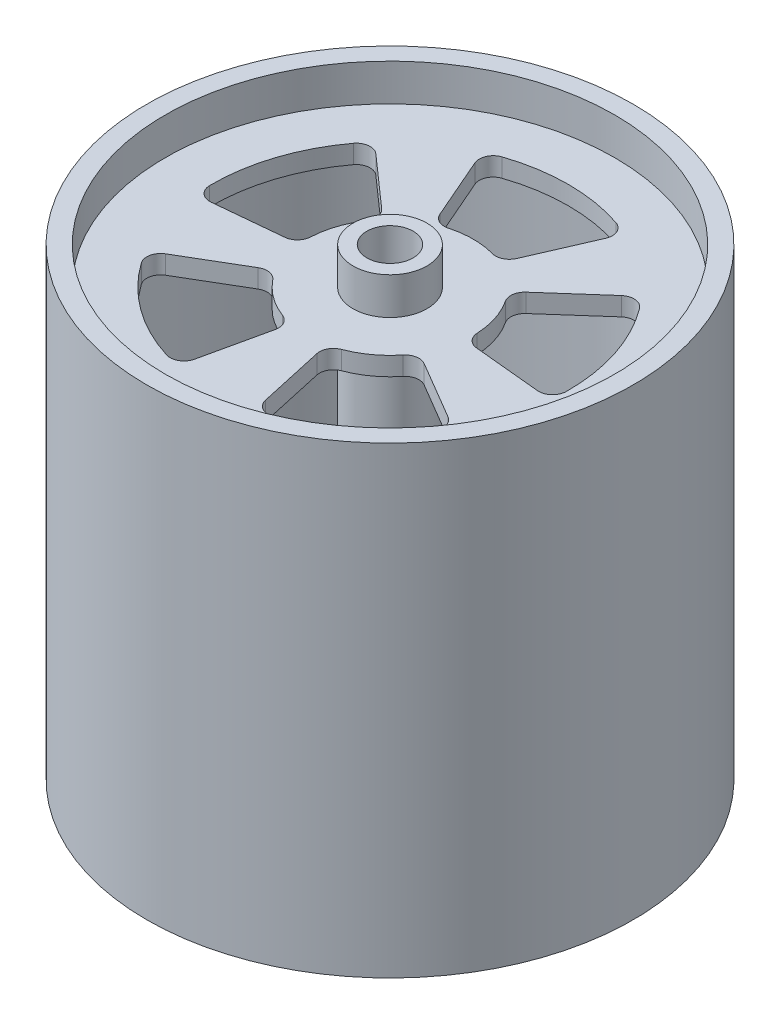
from build123d import *

# Parameters (mm, degrees)
SKETCH1_R           = 52.5
SKETCH1_R_2         = 48.5
BOSS_EXTRUDE1_DEPTH = 100
SKETCH2_R           = 5
BOSS_EXTRUDE2_DEPTH = 100
BOSS_EXTRUDE3_START = -8
SKETCH2_3_R         = 48.5
SKETCH2_3_R_2       = 8
BOSS_EXTRUDE3_DEPTH = 4
BOSS_EXTRUDE4_START = -88
SKETCH2_4_R         = 48.5
SKETCH2_4_R_2       = 8
BOSS_EXTRUDE4_DEPTH = 4


with BuildPart() as part:
    # Sketch1 → Boss-Extrude1 (new body)
    with BuildSketch(Plane(origin=(0, 0, 0), x_dir=(1, 0, 0), z_dir=(0, 1, 0))):
        Circle(SKETCH1_R)
        Circle(SKETCH1_R_2, mode=Mode.SUBTRACT)
    extrude(amount=BOSS_EXTRUDE1_DEPTH)



with BuildPart() as body_2:
    # Sketch2 → Boss-Extrude2 (new body)
    with BuildSketch(Plane.XZ):
        with BuildLine():
            ThreePointArc((8, 0), (7.901506725, 1.25147572), (7.60845213, 2.472135955))
            ThreePointArc((7.60845213, 2.472135955), (4.702282018, 6.472135955), (0, 8))
            ThreePointArc((0, 8), (-5.656854249, -5.656854249), (8, 0))
        make_face()
        Circle(SKETCH2_R, mode=Mode.SUBTRACT)
    extrude(amount=-BOSS_EXTRUDE2_DEPTH)


with BuildPart() as part_1:
    add(part.part)

    add(body_2.part)  # Boss-Extrude3 merges body 2
    # Sketch2<3> → Boss-Extrude3 (add)
    with BuildSketch(Plane.XZ.offset(BOSS_EXTRUDE3_START)):
        Circle(SKETCH2_3_R)
        Circle(SKETCH2_3_R_2, mode=Mode.SUBTRACT)
        with BuildLine():
            Line((4.498612897, 20.291931451), (7.656121129, 34.53453068))
            ThreePointArc((7.656121129, 34.53453068), (9.081556968, 36.48129187), (11.479516965, 36.748750866))
            ThreePointArc((11.479516965, 36.748750866), (22.629732213, 31.147154283), (31.402773148, 22.273657954))
            ThreePointArc((31.402773148, 22.273657954), (31.889414918, 19.910413097), (30.4784189, 17.953160762))
            Line((30.4784189, 17.953160762), (17.908625798, 10.548986777))
            ThreePointArc((17.908625798, 10.548986777), (15.84479345, 10.183097432), (14.045152036, 11.257606507))
            ThreePointArc((14.045152036, 11.257606507), (10.580134541, 14.562305899), (6.366429359, 16.836525093))
            ThreePointArc((6.366429359, 16.836525093), (4.78839072, 18.216044222), (4.498612897, 20.291931451))
        make_face(mode=Mode.SUBTRACT)
        with BuildLine():
            ThreePointArc((-31.402773148, 22.273657954), (-22.629732213, 31.147154283), (-11.479516965, 36.748750866))
            ThreePointArc((-11.479516965, 36.748750866), (-9.081556968, 36.48129187), (-7.656121129, 34.53453068))
            Line((-7.656121129, 34.53453068), (-4.498612897, 20.291931451))
            ThreePointArc((-4.498612897, 20.291931451), (-4.78839072, 18.216044222), (-6.366429359, 16.836525093))
            ThreePointArc((-6.366429359, 16.836525093), (-10.580134541, 14.562305899), (-14.045152036, 11.257606507))
            ThreePointArc((-14.045152036, 11.257606507), (-15.84479345, 10.183097432), (-17.908625798, 10.548986777))
            Line((-17.908625798, 10.548986777), (-30.4784189, 17.953160762))
            ThreePointArc((-30.4784189, 17.953160762), (-31.889414918, 19.910413097), (-31.402773148, 22.273657954))
        make_face(mode=Mode.SUBTRACT)
        with BuildLine():
            Line((8.287843762, -19.060735709), (14.104955724, -32.439177302))
            ThreePointArc((14.104955724, -32.439177302), (14.096031424, -34.851990353), (12.313249487, -36.477854749))
            ThreePointArc((12.313249487, -36.477854749), (0, -38.5), (-12.313249487, -36.477854749))
            ThreePointArc((-12.313249487, -36.477854749), (-14.096031424, -34.851990353), (-14.104955724, -32.439177302))
            Line((-14.104955724, -32.439177302), (-8.287843762, -19.060735709))
            ThreePointArc((-8.287843762, -19.060735709), (-6.83323268, -17.551634794), (-4.745711605, -17.363128214))
            ThreePointArc((-4.745711605, -17.363128214), (0, -18), (4.745711605, -17.363128214))
            ThreePointArc((4.745711605, -17.363128214), (6.83323268, -17.551634794), (8.287843762, -19.060735709))
        make_face(mode=Mode.SUBTRACT)
        with BuildLine():
            Line((-15.566752332, -13.772299075), (-26.492819932, -23.438867123))
            ThreePointArc((-26.492819932, -23.438867123), (-28.790299268, -24.175979847), (-30.887498112, -22.982873197))
            ThreePointArc((-30.887498112, -22.982873197), (-36.615675877, -11.897154283), (-38.497504807, 0.438319126))
            ThreePointArc((-38.497504807, 0.438319126), (-37.502125795, 2.636265233), (-35.21016198, 3.390352984))
            Line((-35.21016198, 3.390352984), (-20.688921471, 1.992116557))
            ThreePointArc((-20.688921471, 1.992116557), (-18.804181667, 1.075037038), (-17.979821767, -0.852061747))
            ThreePointArc((-17.979821767, -0.852061747), (-17.119017293, -5.562305899), (-15.046810695, -9.87894164))
            ThreePointArc((-15.046810695, -9.87894164), (-14.581011618, -11.922543898), (-15.566752332, -13.772299075))
        make_face(mode=Mode.SUBTRACT)
        with BuildLine():
            Line((20.688921471, 1.992116557), (35.21016198, 3.390352984))
            ThreePointArc((35.21016198, 3.390352984), (37.502125795, 2.636265233), (38.497504807, 0.438319126))
            ThreePointArc((38.497504807, 0.438319126), (36.615675877, -11.897154283), (30.887498112, -22.982873197))
            ThreePointArc((30.887498112, -22.982873197), (28.790299268, -24.175979847), (26.492819932, -23.438867123))
            Line((26.492819932, -23.438867123), (15.566752332, -13.772299075))
            ThreePointArc((15.566752332, -13.772299075), (14.581011618, -11.922543898), (15.046810695, -9.87894164))
            ThreePointArc((15.046810695, -9.87894164), (17.119017293, -5.562305899), (17.979821767, -0.852061747))
            ThreePointArc((17.979821767, -0.852061747), (18.804181667, 1.075037038), (20.688921471, 1.992116557))
        make_face(mode=Mode.SUBTRACT)
    extrude(amount=-BOSS_EXTRUDE3_DEPTH)

    # Sketch2<4> → Boss-Extrude4 (add)
    with BuildSketch(Plane.XZ.offset(BOSS_EXTRUDE4_START)):
        Circle(SKETCH2_4_R)
        Circle(SKETCH2_4_R_2, mode=Mode.SUBTRACT)
        with BuildLine():
            Line((4.498612897, 20.291931451), (7.656121129, 34.53453068))
            ThreePointArc((7.656121129, 34.53453068), (9.081556968, 36.48129187), (11.479516965, 36.748750866))
            ThreePointArc((11.479516965, 36.748750866), (22.629732213, 31.147154283), (31.402773148, 22.273657954))
            ThreePointArc((31.402773148, 22.273657954), (31.889414918, 19.910413097), (30.4784189, 17.953160762))
            Line((30.4784189, 17.953160762), (17.908625798, 10.548986777))
            ThreePointArc((17.908625798, 10.548986777), (15.84479345, 10.183097432), (14.045152036, 11.257606507))
            ThreePointArc((14.045152036, 11.257606507), (10.580134541, 14.562305899), (6.366429359, 16.836525093))
            ThreePointArc((6.366429359, 16.836525093), (4.78839072, 18.216044222), (4.498612897, 20.291931451))
        make_face(mode=Mode.SUBTRACT)
        with BuildLine():
            ThreePointArc((-31.402773148, 22.273657954), (-22.629732213, 31.147154283), (-11.479516965, 36.748750866))
            ThreePointArc((-11.479516965, 36.748750866), (-9.081556968, 36.48129187), (-7.656121129, 34.53453068))
            Line((-7.656121129, 34.53453068), (-4.498612897, 20.291931451))
            ThreePointArc((-4.498612897, 20.291931451), (-4.78839072, 18.216044222), (-6.366429359, 16.836525093))
            ThreePointArc((-6.366429359, 16.836525093), (-10.580134541, 14.562305899), (-14.045152036, 11.257606507))
            ThreePointArc((-14.045152036, 11.257606507), (-15.84479345, 10.183097432), (-17.908625798, 10.548986777))
            Line((-17.908625798, 10.548986777), (-30.4784189, 17.953160762))
            ThreePointArc((-30.4784189, 17.953160762), (-31.889414918, 19.910413097), (-31.402773148, 22.273657954))
        make_face(mode=Mode.SUBTRACT)
        with BuildLine():
            Line((8.287843762, -19.060735709), (14.104955724, -32.439177302))
            ThreePointArc((14.104955724, -32.439177302), (14.096031424, -34.851990353), (12.313249487, -36.477854749))
            ThreePointArc((12.313249487, -36.477854749), (0, -38.5), (-12.313249487, -36.477854749))
            ThreePointArc((-12.313249487, -36.477854749), (-14.096031424, -34.851990353), (-14.104955724, -32.439177302))
            Line((-14.104955724, -32.439177302), (-8.287843762, -19.060735709))
            ThreePointArc((-8.287843762, -19.060735709), (-6.83323268, -17.551634794), (-4.745711605, -17.363128214))
            ThreePointArc((-4.745711605, -17.363128214), (0, -18), (4.745711605, -17.363128214))
            ThreePointArc((4.745711605, -17.363128214), (6.83323268, -17.551634794), (8.287843762, -19.060735709))
        make_face(mode=Mode.SUBTRACT)
        with BuildLine():
            Line((-15.566752332, -13.772299075), (-26.492819932, -23.438867123))
            ThreePointArc((-26.492819932, -23.438867123), (-28.790299268, -24.175979847), (-30.887498112, -22.982873197))
            ThreePointArc((-30.887498112, -22.982873197), (-36.615675877, -11.897154283), (-38.497504807, 0.438319126))
            ThreePointArc((-38.497504807, 0.438319126), (-37.502125795, 2.636265233), (-35.21016198, 3.390352984))
            Line((-35.21016198, 3.390352984), (-20.688921471, 1.992116557))
            ThreePointArc((-20.688921471, 1.992116557), (-18.804181667, 1.075037038), (-17.979821767, -0.852061747))
            ThreePointArc((-17.979821767, -0.852061747), (-17.119017293, -5.562305899), (-15.046810695, -9.87894164))
            ThreePointArc((-15.046810695, -9.87894164), (-14.581011618, -11.922543898), (-15.566752332, -13.772299075))
        make_face(mode=Mode.SUBTRACT)
        with BuildLine():
            Line((20.688921471, 1.992116557), (35.21016198, 3.390352984))
            ThreePointArc((35.21016198, 3.390352984), (37.502125795, 2.636265233), (38.497504807, 0.438319126))
            ThreePointArc((38.497504807, 0.438319126), (36.615675877, -11.897154283), (30.887498112, -22.982873197))
            ThreePointArc((30.887498112, -22.982873197), (28.790299268, -24.175979847), (26.492819932, -23.438867123))
            Line((26.492819932, -23.438867123), (15.566752332, -13.772299075))
            ThreePointArc((15.566752332, -13.772299075), (14.581011618, -11.922543898), (15.046810695, -9.87894164))
            ThreePointArc((15.046810695, -9.87894164), (17.119017293, -5.562305899), (17.979821767, -0.852061747))
            ThreePointArc((17.979821767, -0.852061747), (18.804181667, 1.075037038), (20.688921471, 1.992116557))
        make_face(mode=Mode.SUBTRACT)
    extrude(amount=-BOSS_EXTRUDE4_DEPTH)


solid = part_1.part
